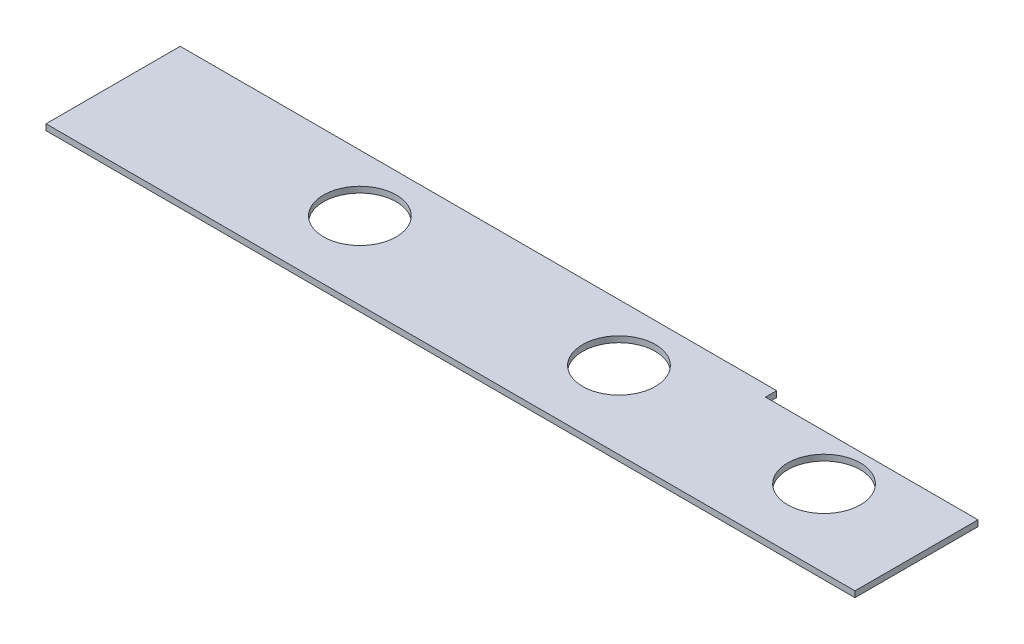
from build123d import *

# Parameters (mm, degrees)
SKETCH2_R           = 9.75
BOSS_EXTRUDE1_DEPTH = 1.6


with BuildPart() as part:
    # Sketch2 → Boss-Extrude1 (new body)
    with BuildSketch(Plane(origin=(0, 0, 0), x_dir=(1, 0, 0), z_dir=(0, 1, 0))):
        Polygon((-108.5, 18), (51.5, 18), (51.5, 15), (108.5, 15), (108.5, -18), (-108.5, -18), align=None)
        with Locations((-45, 2.7)):
            Circle(SKETCH2_R, mode=Mode.SUBTRACT)
        with Locations((24.5, 2.7)):
            Circle(SKETCH2_R, mode=Mode.SUBTRACT)
        with Locations((79.5, 2.7)):
            Circle(SKETCH2_R, mode=Mode.SUBTRACT)
    extrude(amount=BOSS_EXTRUDE1_DEPTH)


solid = part.part
